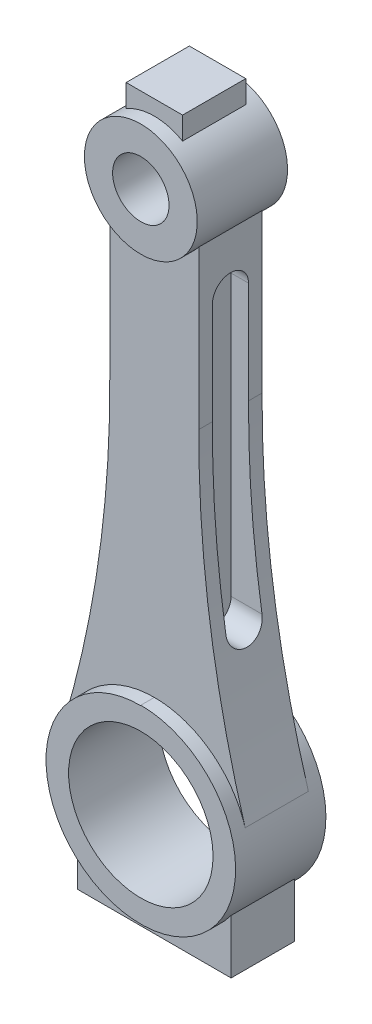
from build123d import *

# Parameters (mm, degrees)
SKETCH2_R             = 6.25
BOSS_EXTRUDE4_DEPTH   = 10
SKETCH2_R_2           = 16
BOSS_EXTRUDE4_2_DEPTH = 10
BOSS_EXTRUDE5_START   = -7
BOSS_EXTRUDE5_DEPTH   = 14
BOSS_EXTRUDE5_2_DEPTH = 14
BOSS_EXTRUDE5_3_DEPTH = 14
CUT_EXTRUDE1_START    = 6
CUT_EXTRUDE1_DEPTH    = 132.802456026
CUT_EXTRUDE2_START    = -6
CUT_EXTRUDE2_DEPTH    = 132.802456026


# Read off the part's stored shape, not the designer's step: Boss-Extrude5
with BuildPart() as part:
    # Sketch2 → Boss-Extrude4 (new, symmetric)
    with BuildSketch(Plane.XY):
        with BuildLine():
            ThreePointArc((-2.605715405, 107.774606459), (-1.309709439, 107.576199752), (0, 107.515719446))
            Line((0, 107.515719446), (0, 107.5))
            ThreePointArc((0, 107.5), (1.310072658, 132.431158821), (-2.605715405, 107.774606459))
        make_face()
        with Locations((0, 120)):
            Circle(SKETCH2_R, mode=Mode.SUBTRACT)
    extrude(amount=BOSS_EXTRUDE4_DEPTH, both=True)

    # Boss-Extrude5 3 outline → Boss-Extrude5 3 (add)
    with BuildSketch(Plane.XY.offset(BOSS_EXTRUDE5_START)):
        with BuildLine():
            ThreePointArc((-6.25, 130.825317548), (0, 132.5), (6.25, 130.825317547))
            Line((6.25, 130.825317547), (6.25, 135.825317547))
            Line((6.25, 135.825317547), (-6.25, 135.825317547))
            Line((-6.25, 135.825317547), (-6.25, 130.825317548))
        make_face()
    extrude(amount=BOSS_EXTRUDE5_3_DEPTH)


with BuildPart() as body_2:
    # Sketch2 → Boss-Extrude4 2 (new, symmetric)
    with BuildSketch(Plane.XY):
        with BuildLine():
            ThreePointArc((20.113639143, 6.036681242), (12.534546141, 16.848891745), (0, 21))
            Line((0, 21), (0, 20.909399801))
            ThreePointArc((0, 20.909399801), (-12.533149824, 16.818613073), (-20.114793765, 6.032832817))
            ThreePointArc((-20.114793765, 6.032832817), (0.002008951, -20.999999904), (20.113639143, 6.036681242))
        make_face()
        Circle(SKETCH2_R_2, mode=Mode.SUBTRACT)
    extrude(amount=BOSS_EXTRUDE4_2_DEPTH, both=True)

    # Boss-Extrude5 2 outline → Boss-Extrude5 2 (add)
    with BuildSketch(Plane.XY.offset(BOSS_EXTRUDE5_START)):
        with BuildLine():
            Line((-17, -12.328828006), (-17, -24.328828006))
            Line((-17, -24.328828006), (17, -24.328828006))
            Line((17, -24.328828006), (17, -12.328828006))
            ThreePointArc((17, -12.328828006), (0, -21), (-17, -12.328828006))
        make_face()
    extrude(amount=BOSS_EXTRUDE5_2_DEPTH)


with BuildPart() as body_3:
    # Boss-Extrude5 outline → Boss-Extrude5 (new body)
    with BuildSketch(Plane.XY.offset(BOSS_EXTRUDE5_START)):
        with BuildLine():
            ThreePointArc((-9.876894189, 77.308172187), (-12.340920148, 41.289152602), (-20.114793765, 6.032832817))
            ThreePointArc((-20.114793765, 6.032832817), (-0.002008951, 20.999999904), (20.113639143, 6.036681242))
            ThreePointArc((20.113639143, 6.036681242), (12.332337725, 41.296257714), (9.862159173, 77.319647375))
            Line((9.862159173, 77.319647375), (9.862159173, 112.319647375))
            ThreePointArc((9.862159173, 112.319647375), (4.281161439, 108.25599486), (-2.605715405, 107.774606459))
            ThreePointArc((-2.605715405, 107.774606459), (-6.645276389, 109.393477757), (-9.876894189, 112.308172187))
            Line((-9.876894189, 112.308172187), (-9.876894189, 77.308172187))
        make_face()
    extrude(amount=BOSS_EXTRUDE5_DEPTH)

    # Sketch3 → Cut-Extrude1 (cut, through all)
    with BuildSketch(Plane(origin=(0, 0, 0), x_dir=(0, 0, -1), z_dir=(1, 0, 0)).offset(CUT_EXTRUDE1_START)):
        with BuildLine():
            Line((4, 99.888786358), (4, 37.888786358))
            ThreePointArc((4, 37.888786358), (0, 33.888786358), (-4, 37.888786358))
            Line((-4, 37.888786358), (-4, 99.888786358))
            ThreePointArc((-4, 99.888786358), (0, 103.888786358), (4, 99.888786358))
        make_face()
    extrude(amount=CUT_EXTRUDE1_DEPTH, mode=Mode.SUBTRACT)

    # Sketch3<2> → Cut-Extrude2 (cut, through all)
    with BuildSketch(Plane(origin=(0, 0, 0), x_dir=(0, 0, -1), z_dir=(1, 0, 0)).offset(CUT_EXTRUDE2_START)):
        with BuildLine():
            Line((4, 99.888786358), (4, 37.888786358))
            ThreePointArc((4, 37.888786358), (0, 33.888786358), (-4, 37.888786358))
            Line((-4, 37.888786358), (-4, 99.888786358))
            ThreePointArc((-4, 99.888786358), (0, 103.888786358), (4, 99.888786358))
        make_face()
    extrude(amount=-CUT_EXTRUDE2_DEPTH, mode=Mode.SUBTRACT)


solid = Compound([part.part, body_2.part, body_3.part])
